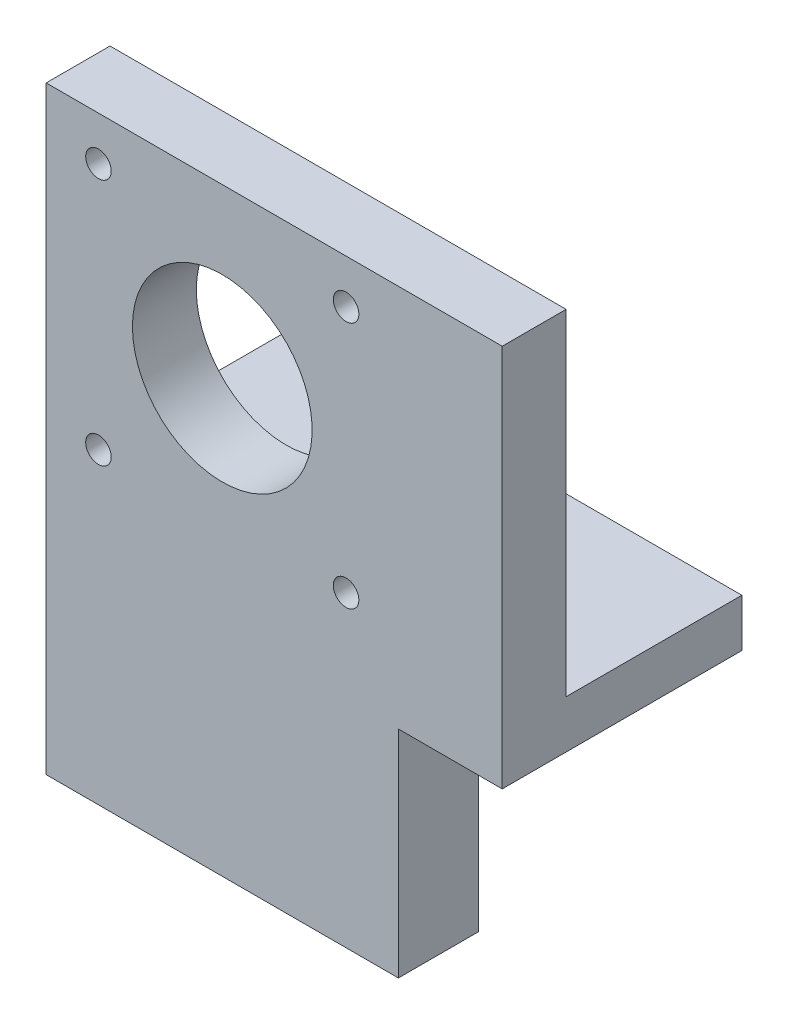
from build123d import *

# Parameters (mm, degrees)
SKETCH3_W                                       = 44.1
SKETCH3_H                                       = 30
BOSS_EXTRUDE1_DEPTH                             = 8
SKETCH4_W                                       = 44.1
SKETCH4_H                                       = 10
BOSS_EXTRUDE2_DEPTH                             = 25
CSK_FOR_M3_FLAT_HEAD_MACHINE_SCREW1_D           = 3.2
CSK_FOR_M3_FLAT_HEAD_MACHINE_SCREW1_CSINK_D     = 6.3
CSK_FOR_M3_FLAT_HEAD_MACHINE_SCREW1_CSINK_ANGLE = 90
SKETCH10_W                                      = 44.1
SKETCH10_H                                      = 8
BOSS_EXTRUDE3_DEPTH                             = 42
SKETCH11_R                                      = 11.25
CUT_EXTRUDE1_DEPTH                              = 42
M3_CLEARANCE_HOLE4_D                            = 3.2
BOSS_EXTRUDE4_DEPTH                             = 13
CHAMFER2_SIZE                                   = 2


with BuildPart() as part:
    # Sketch3 → Boss-Extrude1 (new body)
    with BuildSketch(Plane(origin=(0, 0, 0), x_dir=(1, 0, 0), z_dir=(0, 1, 0))):
        with Locations((0, -5)):
            Rectangle(SKETCH3_W, SKETCH3_H)
    extrude(amount=-BOSS_EXTRUDE1_DEPTH)

    # Sketch4 → Boss-Extrude2 (add)
    with BuildSketch(Plane.XZ.offset(8)):
        with Locations((0, 15)):
            Rectangle(SKETCH4_W, SKETCH4_H)
    extrude(amount=BOSS_EXTRUDE2_DEPTH)

    # CSK for M3 Flat Head Machine Screw1 (through all)
    with Locations(Plane(origin=(0, 0, 0), x_dir=(1, 0, 0), z_dir=(0, 1, 0))):
        with Locations((8, -7.5), (-8, -7.5), (8, 7.5), (-8, 7.5)):
            CounterSinkHole(CSK_FOR_M3_FLAT_HEAD_MACHINE_SCREW1_D / 2, CSK_FOR_M3_FLAT_HEAD_MACHINE_SCREW1_CSINK_D / 2, counter_sink_angle=CSK_FOR_M3_FLAT_HEAD_MACHINE_SCREW1_CSINK_ANGLE)

    # Sketch10 → Boss-Extrude3 (add)
    with BuildSketch(Plane(origin=(0, 0, 0), x_dir=(1, 0, 0), z_dir=(0, 1, 0))):
        with Locations((0, -16)):
            Rectangle(SKETCH10_W, SKETCH10_H)
    extrude(amount=BOSS_EXTRUDE3_DEPTH)

    # Sketch11 → Cut-Extrude1 (cut)
    with BuildSketch(Plane(origin=(0, 0, 12), x_dir=(-1, 0, 0), z_dir=(0, 0, -1))):
        with Locations((0, 21)):
            Circle(SKETCH11_R)
    extrude(amount=-CUT_EXTRUDE1_DEPTH, mode=Mode.SUBTRACT)

    # M3 Clearance Hole4 (through all)
    with Locations(Plane(origin=(0, 0, 12), x_dir=(-1, 0, 0), z_dir=(0, 0, -1))):
        with Locations((15.5, 5.5), (-15.5, 5.5), (15.5, 36.5), (-15.5, 36.5)):
            Hole(M3_CLEARANCE_HOLE4_D / 2)

    # Sketch14 → Boss-Extrude4 (add)
    with BuildSketch(Plane(origin=(22.05, 0, 0), x_dir=(0, 0, -1), z_dir=(1, 0, 0))):
        Polygon((10, 0), (-10, 0), (-12, 0), (-12, 42), (-20, 42), (-20, -6), (-12, -6), (-10, -6), (10, -6), align=None)
    extrude(amount=BOSS_EXTRUDE4_DEPTH)

    # Chamfer2
    chamfer2_edges = [part.edges().sort_by_distance(p)[0] for p in [
        (-22.05, -8, 0),
    ]]
    chamfer(chamfer2_edges, length=CHAMFER2_SIZE)


solid = part.part
